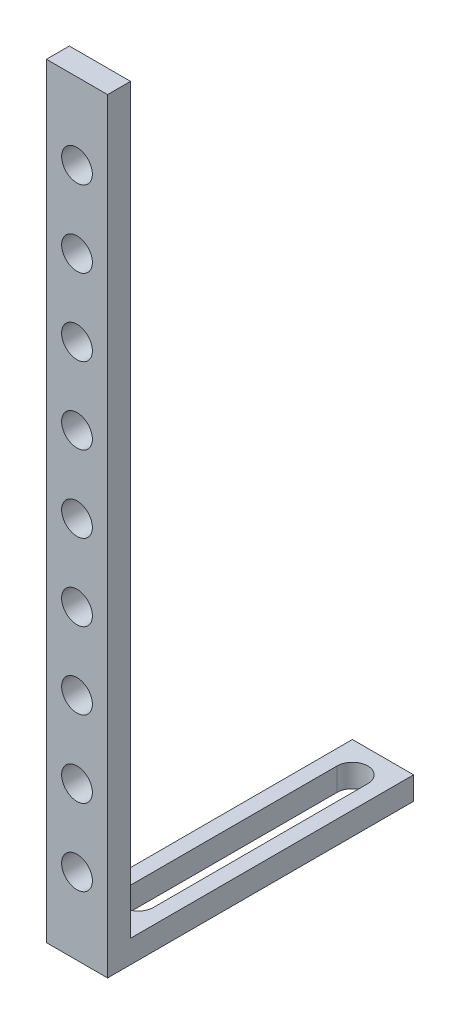
from build123d import *

# Parameters (mm, degrees)
EXTRUDE_1_DEPTH     = 40
SKETCH_2_R          = 10.05
CUT_EXTRUDE_1_DEPTH = 541
CUT_EXTRUDE_2_REACH = 542


with BuildPart() as part:
    # Эскиз1 → Бобышка-Вытянуть1 (new body)
    with BuildSketch(Plane(origin=(0, 0, 0), x_dir=(0, 0, -1), z_dir=(1, 0, 0))):
        Polygon((0, 0), (0, 500), (15, 500), (15, 15), (200, 15), (200, 0), align=None)
    extrude(amount=EXTRUDE_1_DEPTH)

    # Эскиз2 → Вырез-Вытянуть1 (cut, through all)
    with BuildSketch(Plane.XY):
        with Locations((20, 50)):
            Circle(SKETCH_2_R)
        with Locations((20, 100)):
            Circle(SKETCH_2_R)
        with Locations((20, 150)):
            Circle(SKETCH_2_R)
        with Locations((20, 200)):
            Circle(SKETCH_2_R)
        with Locations((20, 250)):
            Circle(SKETCH_2_R)
        with Locations((20, 300)):
            Circle(SKETCH_2_R)
        with Locations((20, 350)):
            Circle(SKETCH_2_R)
        with Locations((20, 400)):
            Circle(SKETCH_2_R)
        with Locations((20, 450)):
            Circle(SKETCH_2_R)
    extrude(amount=-CUT_EXTRUDE_1_DEPTH, mode=Mode.SUBTRACT)

    # Эскиз3 → Вырез-Вытянуть2 (cut, up to next)
    with BuildSketch(Plane.XZ, mode=Mode.PRIVATE) as cut_extrude_2_sk1:
        with BuildLine():
            Line((9.95, -40), (9.95, -180))
            ThreePointArc((9.95, -180), (20, -190.05), (30.05, -180))
            Line((30.05, -180), (30.05, -40))
            ThreePointArc((30.05, -40), (20, -29.95), (9.95, -40))
        make_face()
    cut_extrude_2_tool1 = extrude(cut_extrude_2_sk1.sketch, amount=-CUT_EXTRUDE_2_REACH, mode=Mode.PRIVATE) & part.part
    add(cut_extrude_2_tool1.solids().sort_by_distance((20, 0, -110))[0], mode=Mode.SUBTRACT)


solid = part.part
